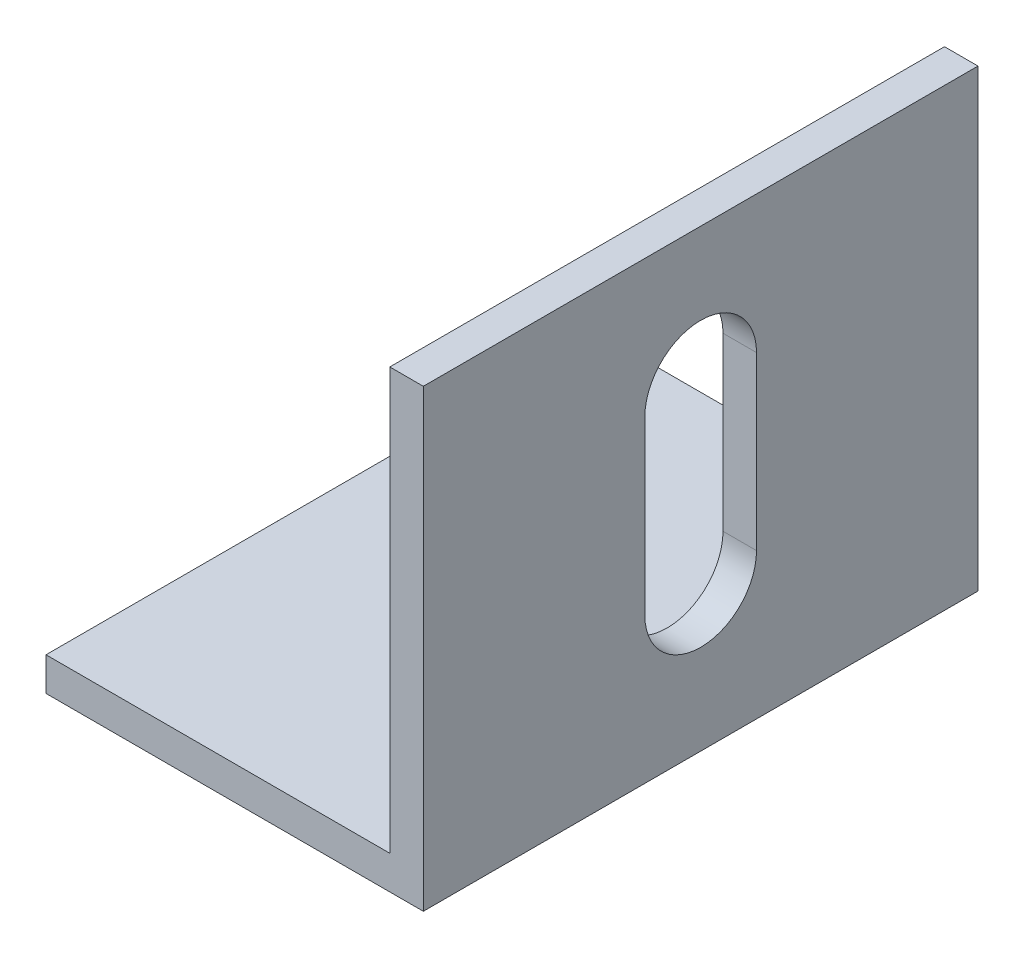
from build123d import *

# Parameters (mm, degrees)
BOSS_EXTRUDE1_DEPTH       = 12.6111
F_8_CLEARANCE_HOLE1_D     = 4.4958
F_8_CLEARANCE_HOLE1_DEPTH = 31.75
F_8_CLEARANCE_HOLE1_TIP   = 1.350674586
CUT_EXTRUDE1_DEPTH        = 28.75312958


with BuildPart() as part:
    # Sketch1 → Boss-Extrude1 (new, symmetric)
    with BuildSketch(Plane.XY):
        Polygon((-15.6337, 0), (0, 0), (0, 19.1516), (1.524, 19.1516), (1.524, -1.524), (-15.6337, -1.524), align=None)
    extrude(amount=BOSS_EXTRUDE1_DEPTH, both=True)

    # #8 Clearance Hole1
    with Locations(Plane(origin=(0, 0, 0), x_dir=(1, 0, 0), z_dir=(0, 1, 0))):
        with Locations((-7.81685, 0)):
            Hole(F_8_CLEARANCE_HOLE1_D / 2, depth=F_8_CLEARANCE_HOLE1_DEPTH)
            with Locations((0, 0, -(F_8_CLEARANCE_HOLE1_DEPTH + F_8_CLEARANCE_HOLE1_TIP / 2))):  # 118° drill point
                Cone(0, F_8_CLEARANCE_HOLE1_D / 2, F_8_CLEARANCE_HOLE1_TIP, mode=Mode.SUBTRACT)

    # Sketch5 → Cut-Extrude1 (cut, through all)
    with BuildSketch(Plane.ZY):
        with BuildLine():
            Line((2.54, 12.9032), (2.54, 5.1054))
            ThreePointArc((2.54, 5.1054), (0, 2.5654), (-2.54, 5.1054))
            Line((-2.54, 5.1054), (-2.54, 12.9032))
            ThreePointArc((-2.54, 12.9032), (0, 15.4432), (2.54, 12.9032))
        make_face()
    extrude(amount=-CUT_EXTRUDE1_DEPTH, mode=Mode.SUBTRACT)


solid = part.part
